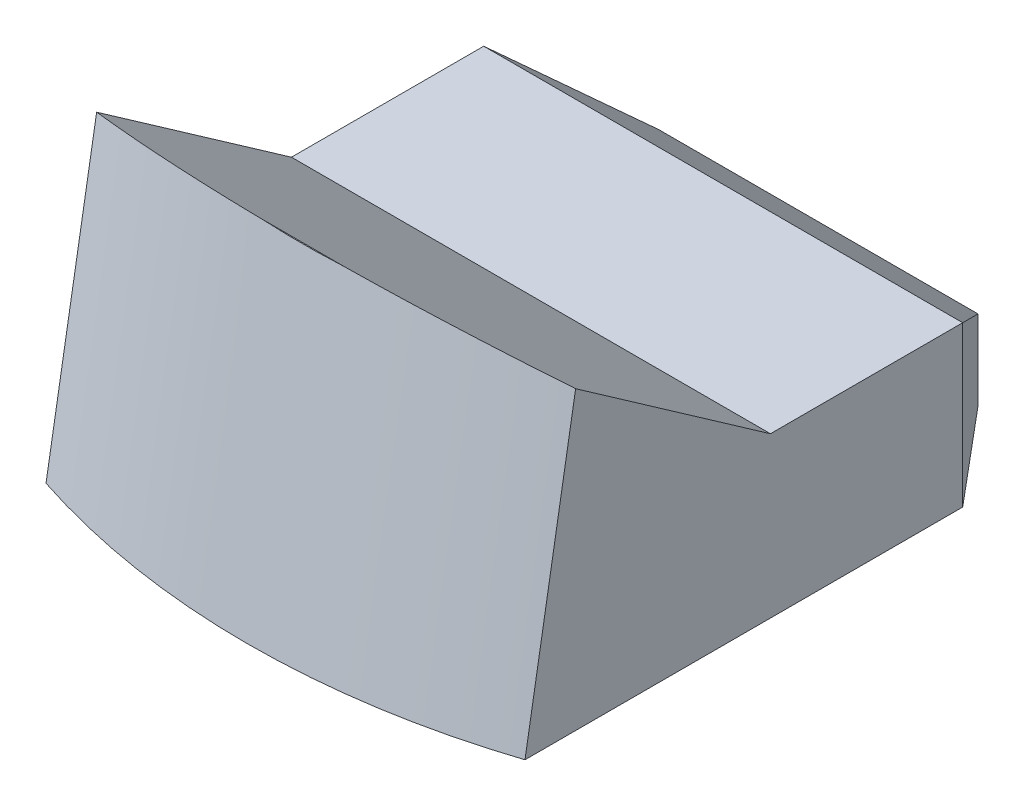
from build123d import *

# Parameters (mm, degrees)
SKETCH_1_W          = 3
SKETCH_1_H          = 3.8
EXTRUDE_1_DEPTH     = 1
SKETCH_2_W          = 3
SKETCH_2_H          = 2
EXTRUDE_2_DEPTH     = 1
CHAMFER_1_SIZE      = 0.5
CHAMFER_1_SIZE2     = 0.595876796
CHAMFER_3_SIZE      = 1
CHAMFER_3_SIZE_2    = 1.428148007
CUT_EXTRUDE_1_DEPTH = 3.4


with BuildPart() as part:
    # 草图1 → 凸台-拉伸1 (new body)
    with BuildSketch(Plane(origin=(0, 0, 0), x_dir=(1, 0, 0), z_dir=(0, 1, 0))):
        with Locations((0, -0.9)):
            Rectangle(SKETCH_1_W, SKETCH_1_H)
    extrude(amount=EXTRUDE_1_DEPTH)

    # 草图2 → 凸台-拉伸2 (add)
    with BuildSketch(Plane(origin=(0, 1, 0), x_dir=(1, 0, 0), z_dir=(0, 1, 0))):
        with Locations((0, -1.8)):
            Rectangle(SKETCH_2_W, SKETCH_2_H)
    extrude(amount=EXTRUDE_2_DEPTH)

    # 倒角1
    chamfer_1_edges = [part.edges().sort_by_distance(p)[0] for p in [
        (0, 1, -1),
        (-1.5, 0.5, -1),
        (1.5, 0.5, -1),
    ]]
    chamfer_1_side = [part.faces().sort_by_distance(p)[0] for p in [
        (0, 0.5, -1),
    ]]
    chamfer(chamfer_1_edges, length=CHAMFER_1_SIZE, length2=CHAMFER_1_SIZE2, reference=chamfer_1_side[0])

    # 倒角3
    # the kernel refuses this chamfer: 1.428148007, 1 mm, written as the material it takes off along each edge
    with BuildSketch(Plane(origin=(5.18826682, 2, 0.8), x_dir=(0, -0.9989750717851554, -0.04526373771402124), z_dir=(-1, 0, 0))) as chamfer_3_piece_1_section:
        Polygon((CHAMFER_3_SIZE * 0.998975071785, CHAMFER_3_SIZE * 0.045263737714), (-CHAMFER_3_SIZE_2 * 0.0452637377058, CHAMFER_3_SIZE_2 * 0.998975071605), (0, 0), align=None)
    chamfer_3_piece_1 = extrude(amount=10.37653364, mode=Mode.PRIVATE)
    chamfer_3_piece_1 = split(chamfer_3_piece_1, bisect_by=Plane(origin=(0, 1, 1.276872226), z_dir=(0, 1, 0)), keep=Keep.TOP, mode=Mode.PRIVATE)
    add(chamfer_3_piece_1, mode=Mode.SUBTRACT)

    # 草图4 → 切除-拉伸1 (cut, along a direction that is not the sketch's normal)
    with BuildSketch(Plane.XZ):
        with BuildLine():
            Line((1.59999292, 2.303360359), (2.090500244, 2.793867684))
            Line((2.090500244, 2.793867684), (1.845246582, 3.265265737))
            Line((1.845246582, 3.265265737), (0.278729323, 3.46880384))
            Line((0.278729323, 3.46880384), (-0.130829053, 3.46880384))
            Line((-0.130829053, 3.46880384), (-1.91054636, 3.486179043))
            Line((-1.91054636, 3.486179043), (-2.191031794, 2.570257584))
            Line((-2.191031794, 2.570257584), (-1.60000708, 2.303360359))
            ThreePointArc((-1.60000708, 2.303360359), (-7.08e-06, 2.577223661), (1.59999292, 2.303360359))
        make_face()
    extrude(amount=-CUT_EXTRUDE_1_DEPTH, dir=(0, -0.9856835463912937, 0.16860589068440726), mode=Mode.SUBTRACT)


solid = part.part
